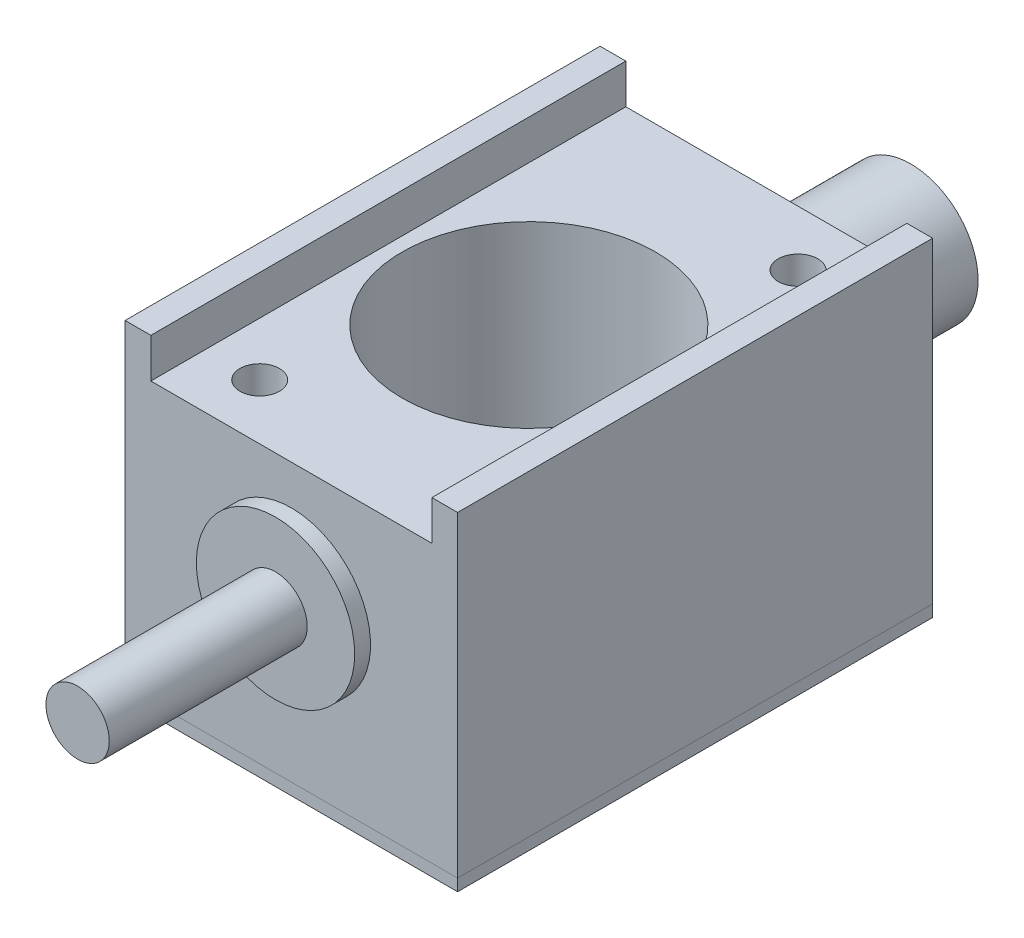
from build123d import *

# Parameters (mm, degrees)
SKETCH1_W           = 42
SKETCH1_H           = 40
BOSS_EXTRUDE1_DEPTH = 60
SKETCH2_W           = 35.5
SKETCH2_H           = 5
CUT_EXTRUDE1_DEPTH  = 60
SKETCH3_R           = 16
CUT_EXTRUDE2_DEPTH  = 40
SKETCH4_R           = 8.5
BOSS_EXTRUDE2_DEPTH = 18.25
SKETCH6_R           = 12.5
BOSS_EXTRUDE3_DEPTH = 2
SKETCH7_R           = 10
BOSS_EXTRUDE4_DEPTH = 2
SKETCH8_R           = 4
BOSS_EXTRUDE5_DEPTH = 25
SKETCH9_R           = 2.5
CUT_EXTRUDE6_DEPTH  = 32
SKETCH10_W          = 42
SKETCH10_H          = 60
SKETCH10_R          = 2.5
SKETCH10_R_2        = 6.75
SKETCH10_R_3        = 1.6
SKETCH10_R_4        = 1.55
BASE_FLANGE1_DEPTH  = 1.5
SKETCH15_R          = 2.5
CUT_EXTRUDE7_DEPTH  = 99.030607465


# Sheet-metal steps are written as plain solids
with BuildPart() as part:
    # Sketch1 → Boss-Extrude1 (new body)
    with BuildSketch(Plane.XY):
        Rectangle(SKETCH1_W, SKETCH1_H)
    extrude(amount=BOSS_EXTRUDE1_DEPTH)

    # Sketch2 → Cut-Extrude1 (cut)
    with BuildSketch(Plane.XY.offset(60)):
        with Locations((0, 17.5)):
            Rectangle(SKETCH2_W, SKETCH2_H)
    extrude(amount=-CUT_EXTRUDE1_DEPTH, mode=Mode.SUBTRACT)

    # Sketch3 → Cut-Extrude2 (cut)
    with BuildSketch(Plane(origin=(0, 15, 0), x_dir=(1, 0, 0), z_dir=(0, 1, 0))):
        with Locations(Location((0, -30, 0), (0, 0, 270))):
            Circle(SKETCH3_R)
    extrude(amount=-CUT_EXTRUDE2_DEPTH, mode=Mode.SUBTRACT)

    # Sketch4 → Boss-Extrude2 (add)
    with BuildSketch(Plane(origin=(0, 0, 0), x_dir=(-1, 0, 0), z_dir=(0, 0, -1))):
        Circle(SKETCH4_R)
    extrude(amount=BOSS_EXTRUDE2_DEPTH)

    # Sketch6 → Boss-Extrude3 (add)
    with BuildSketch(Plane(origin=(0, 0, 0), x_dir=(-1, 0, 0), z_dir=(0, 0, -1))):
        Circle(SKETCH6_R)
    extrude(amount=BOSS_EXTRUDE3_DEPTH)

    # Sketch7 → Boss-Extrude4 (add)
    with BuildSketch(Plane.XY.offset(60)):
        with Locations(Location((0, 0, 0), (0, 0, 180))):
            Circle(SKETCH7_R)
    extrude(amount=BOSS_EXTRUDE4_DEPTH)

    # Sketch8 → Boss-Extrude5 (add)
    with BuildSketch(Plane.XY.offset(62)):
        Circle(SKETCH8_R)
    extrude(amount=BOSS_EXTRUDE5_DEPTH)

    # Sketch9 → Cut-Extrude6 (cut)
    with BuildSketch(Plane(origin=(0, 0, -18.25), x_dir=(-1, 0, 0), z_dir=(0, 0, -1))):
        Circle(SKETCH9_R)
    extrude(amount=-CUT_EXTRUDE6_DEPTH, mode=Mode.SUBTRACT)

    # Sketch15 → Cut-Extrude7 (cut, through all)
    with BuildSketch(Plane.XZ.offset(20)):
        with Locations(Location((-11, 53, 0), (0, 0, 270))):
            Circle(SKETCH15_R)
        with Locations(Location((11, 7, 0), (0, 0, 270))):
            Circle(SKETCH15_R)
    extrude(amount=-CUT_EXTRUDE7_DEPTH, mode=Mode.SUBTRACT)


with BuildPart() as body_2:
    # Sketch10 → Base-Flange1 (new body)
    with BuildSketch(Plane.XZ.offset(20)):
        with Locations((0, 30)):
            Rectangle(SKETCH10_W, SKETCH10_H)
        with Locations(Location((-11, 53, 0), (0, 0, 270))):
            Circle(SKETCH10_R, mode=Mode.SUBTRACT)
        with Locations(Location((11, 7, 0), (0, 0, 270))):
            Circle(SKETCH10_R, mode=Mode.SUBTRACT)
        with Locations(Location((0, 30, 0), (0, 0, 270))):
            Circle(SKETCH10_R_2, mode=Mode.SUBTRACT)
        with Locations(Location((0, 40.7, 0), (0, 0, 270))):
            Circle(SKETCH10_R_3, mode=Mode.SUBTRACT)
        with Locations(Location((0, 19.3, 0), (0, 0, 270))):
            Circle(SKETCH10_R_3, mode=Mode.SUBTRACT)
        with Locations(Location((-11.2, 30, 0), (0, 0, 270))):
            Circle(SKETCH10_R_4, mode=Mode.SUBTRACT)
        with Locations(Location((11.2, 30, 0), (0, 0, 270))):
            Circle(SKETCH10_R_4, mode=Mode.SUBTRACT)
    extrude(amount=BASE_FLANGE1_DEPTH)


solid = Compound([part.part, body_2.part])
